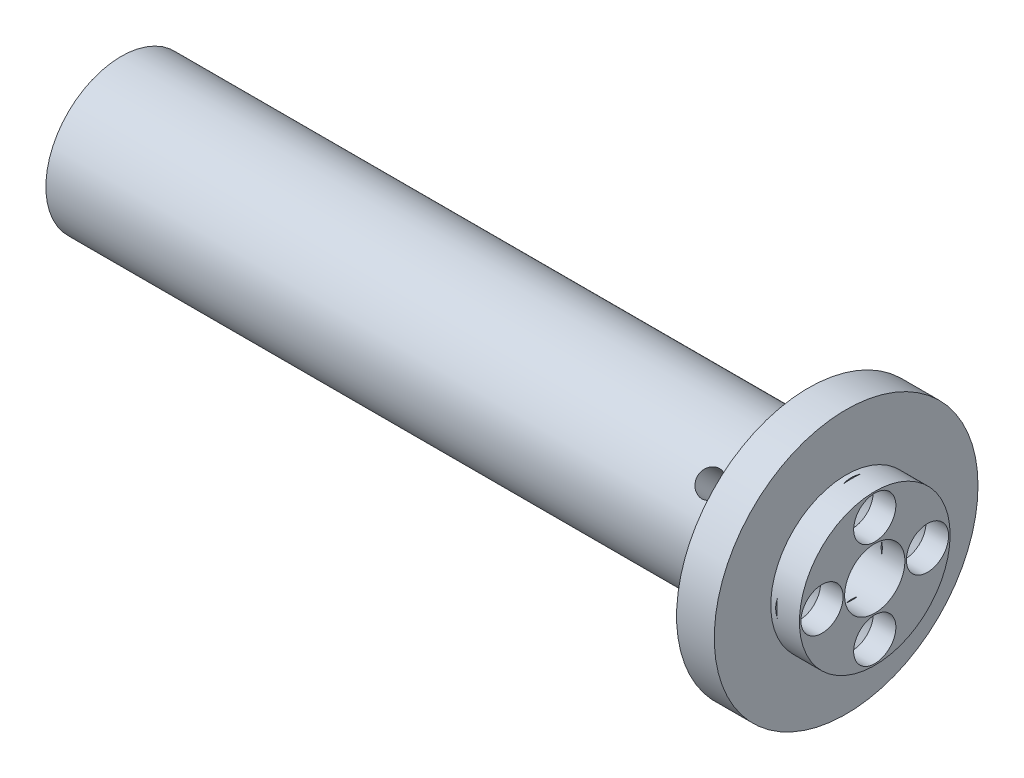
from build123d import *

# Parameters (mm, degrees)
SKETCH13_R                                   = 2.8
CUT_EXTRUDE1_DEPTH                           = 3
CSK_FOR_M3_COUNTERSUNK_RAISED_HEAD_S_2_COUNT = 2
CSK_FOR_M3_COUNTERSUNK_RAISED_HEAD_S_2_PITCH = 9.899494937
CSK_FOR_M3_COUNTERSUNK_RAISED_HEAD_S_3_COUNT = 2
CSK_FOR_M3_COUNTERSUNK_RAISED_HEAD_S_3_PITCH = 14
CSK_FOR_M3_COUNTERSUNK_RAISED_HEAD_S_4_COUNT = 2
CSK_FOR_M3_COUNTERSUNK_RAISED_HEAD_S_4_PITCH = 9.899494937
M4_START                                     = 3.643830283
M4_TAPPED_HOLE2_OUTLINE_R                    = 1.65
M4_TAPPED_HOLE2_DEPTH                        = 6.356169708
SKETCH14_R                                   = 17.5
SKETCH14_R_2                                 = 2.8
SKETCH14_R_3                                 = 4
BOSS_EXTRUDE1_DEPTH                          = 3


# Read off the part's stored shape, not the designer's step: M4 Tapped Hole2
with BuildPart() as part:
    # Sketch1 → Revolve2 (revolve)
    with BuildSketch(Plane(origin=(0, 0, 0), x_dir=(1, 0, 0), z_dir=(0, 1, 0))):
        Polygon((-3.8, 10), (-3.8, 17.5), (-8.8, 17.5), (-8.8, 10), (-100, 10), (-100, 0), (-19, 0), (-19, 4), (0, 4), (0, 10), align=None)
    revolve(axis=Axis((0, 0, 0), (-1, 0, 0)))


with BuildPart() as body_2:
    # Split1: the piece on the far side of the plane
    add(part.part)
    split(bisect_by=Plane(origin=(-8.8, 0, 0), x_dir=(0, 0, -1), z_dir=(-1, 0, 0)), keep=Keep.BOTTOM)

    # Sketch13 → Cut-Extrude1 (cut)
    with BuildSketch(Plane(origin=(0, 0, 0), x_dir=(0, 0, -1), z_dir=(1, 0, 0))):
        with Locations((0, 7)):
            Circle(SKETCH13_R)
        with Locations((7, 0)):
            Circle(SKETCH13_R)
        with Locations((0, -7)):
            Circle(SKETCH13_R)
        with Locations((-7, 0)):
            Circle(SKETCH13_R)
    extrude(amount=-CUT_EXTRUDE1_DEPTH, mode=Mode.SUBTRACT)


with BuildPart() as part_1:
    add(part.part)

    # Split1
    split(bisect_by=Plane(origin=(-8.8, 0, 0), x_dir=(0, 0, -1), z_dir=(-1, 0, 0)), keep=Keep.TOP)


with BuildPart() as csk_for_m3_countersunk_raised_head_screw_tool:
    # Sketch7 → CSK for M3 Countersunk Raised Head Screw2 (revolve)
    with BuildSketch(Plane(origin=(-3, 0, 7), x_dir=(0, 0, -1), z_dir=(0, 1, 0))):
        Polygon((0, 0), (0, 11.021463052), (1.7, 10), (1.7, 1.45), (3.15, 0), align=None)
    csk_for_m3_countersunk_raised_head_screw = revolve(axis=Axis((3.35, 0, 7), (-1, 0, 0)))


with BuildPart() as part_2:
    add(part_1.part)

    # CSK for M3 Countersunk Raised Head Screw2: cut by csk_for_m3_countersunk_raised_head_screw_tool
    add(csk_for_m3_countersunk_raised_head_screw_tool.part, mode=Mode.SUBTRACT)


with BuildPart() as body_2_1:
    add(body_2.part)

    # CSK for M3 Countersunk Raised Head Screw2: cut by csk_for_m3_countersunk_raised_head_screw_tool
    add(csk_for_m3_countersunk_raised_head_screw_tool.part, mode=Mode.SUBTRACT)


with BuildPart() as csk_for_m3_countersunk_raised_head_s_2_tool:
    # CSK for M3 Countersunk Raised Head S 2: CSK for M3 Countersunk Raised Head Screw2 ×2
    with Locations(*[Vector(0, 0.7071067811865476, -0.7071067811865476) * (i * CSK_FOR_M3_COUNTERSUNK_RAISED_HEAD_S_2_PITCH) for i in range(1, CSK_FOR_M3_COUNTERSUNK_RAISED_HEAD_S_2_COUNT)]):
        add(csk_for_m3_countersunk_raised_head_screw)


with BuildPart() as part_3:
    add(part_2.part)

    # CSK for M3 Countersunk Raised Head S 2: cut by csk_for_m3_countersunk_raised_head_s_2_tool
    add(csk_for_m3_countersunk_raised_head_s_2_tool.part, mode=Mode.SUBTRACT)


with BuildPart() as body_2_2:
    add(body_2_1.part)

    # CSK for M3 Countersunk Raised Head S 2: cut by csk_for_m3_countersunk_raised_head_s_2_tool
    add(csk_for_m3_countersunk_raised_head_s_2_tool.part, mode=Mode.SUBTRACT)


with BuildPart() as csk_for_m3_countersunk_raised_head_s_3_tool:
    # CSK for M3 Countersunk Raised Head S 3: CSK for M3 Countersunk Raised Head Screw2 ×2
    with Locations(*[(0, 0, -i * CSK_FOR_M3_COUNTERSUNK_RAISED_HEAD_S_3_PITCH) for i in range(1, CSK_FOR_M3_COUNTERSUNK_RAISED_HEAD_S_3_COUNT)]):
        add(csk_for_m3_countersunk_raised_head_screw)


with BuildPart() as part_4:
    add(part_3.part)

    # CSK for M3 Countersunk Raised Head S 3: cut by csk_for_m3_countersunk_raised_head_s_3_tool
    add(csk_for_m3_countersunk_raised_head_s_3_tool.part, mode=Mode.SUBTRACT)


with BuildPart() as body_2_3:
    add(body_2_2.part)

    # CSK for M3 Countersunk Raised Head S 3: cut by csk_for_m3_countersunk_raised_head_s_3_tool
    add(csk_for_m3_countersunk_raised_head_s_3_tool.part, mode=Mode.SUBTRACT)


with BuildPart() as csk_for_m3_countersunk_raised_head_s_4_tool:
    # CSK for M3 Countersunk Raised Head S 4: CSK for M3 Countersunk Raised Head Screw2 ×2
    with Locations(*[Vector(0, -0.7071067811865476, -0.7071067811865476) * (i * CSK_FOR_M3_COUNTERSUNK_RAISED_HEAD_S_4_PITCH) for i in range(1, CSK_FOR_M3_COUNTERSUNK_RAISED_HEAD_S_4_COUNT)]):
        add(csk_for_m3_countersunk_raised_head_screw)


with BuildPart() as part_5:
    add(part_4.part)

    # CSK for M3 Countersunk Raised Head S 4: cut by csk_for_m3_countersunk_raised_head_s_4_tool
    add(csk_for_m3_countersunk_raised_head_s_4_tool.part, mode=Mode.SUBTRACT)

    # M4 Tapped Hole2 outline → M4 Tapped Hole2 (cut)
    with BuildSketch(Plane(origin=(0, 0, 0), x_dir=(1, 0, 0), z_dir=(0, 0.707106781186546, 0.707106781186549)).offset(M4_START)):
        with Locations((-14.8, 0)):
            Circle(M4_TAPPED_HOLE2_OUTLINE_R)
    extrude(amount=M4_TAPPED_HOLE2_DEPTH, mode=Mode.SUBTRACT)


with BuildPart() as body_2_4:
    add(body_2_3.part)

    # CSK for M3 Countersunk Raised Head S 4: cut by csk_for_m3_countersunk_raised_head_s_4_tool
    add(csk_for_m3_countersunk_raised_head_s_4_tool.part, mode=Mode.SUBTRACT)

    # Sketch14 → Boss-Extrude1 (add)
    with BuildSketch(Plane(origin=(-3.8, 0, 0), x_dir=(0, 0, -1), z_dir=(1, 0, 0))):
        Circle(SKETCH14_R)
        with Locations((0, 7)):
            Circle(SKETCH14_R_2, mode=Mode.SUBTRACT)
        with Locations((7, 0)):
            Circle(SKETCH14_R_2, mode=Mode.SUBTRACT)
        with Locations((0, -7)):
            Circle(SKETCH14_R_2, mode=Mode.SUBTRACT)
        with Locations((-7, 0)):
            Circle(SKETCH14_R_2, mode=Mode.SUBTRACT)
        Circle(SKETCH14_R_3, mode=Mode.SUBTRACT)
    extrude(amount=-BOSS_EXTRUDE1_DEPTH)


solid = Compound([part_5.part, body_2_4.part])
